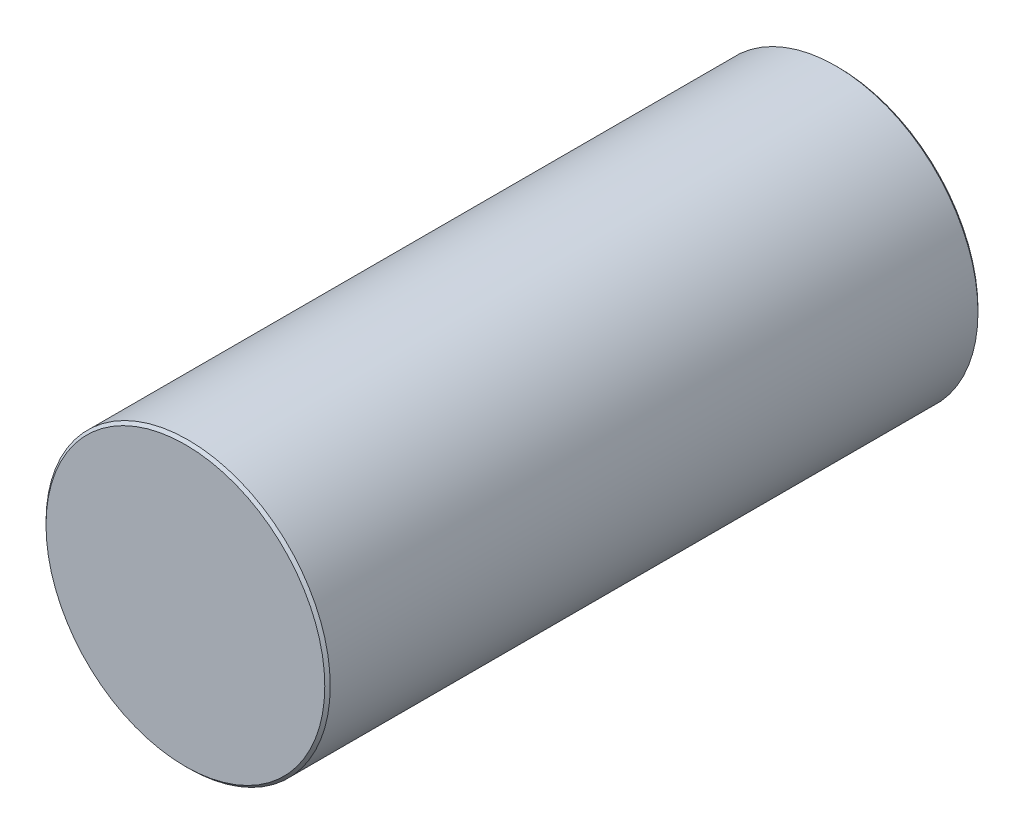
from build123d import *

# Parameters (mm, degrees)
SKETCH2_R           = 2.6
BOSS_EXTRUDE1_DEPTH = 11.95
CHAMFER2_SIZE       = 0.05


with BuildPart() as part:
    # Sketch2 → Boss-Extrude1 (new body)
    with BuildSketch(Plane.XY):
        Circle(SKETCH2_R)
    extrude(amount=BOSS_EXTRUDE1_DEPTH)

    # Chamfer2
    chamfer2_edges = [part.edges().sort_by_distance(p)[0] for p in [
        (-2.6, 0, 11.95),
        (-2.6, 0, 0),
    ]]
    chamfer(chamfer2_edges, length=CHAMFER2_SIZE)


solid = part.part
